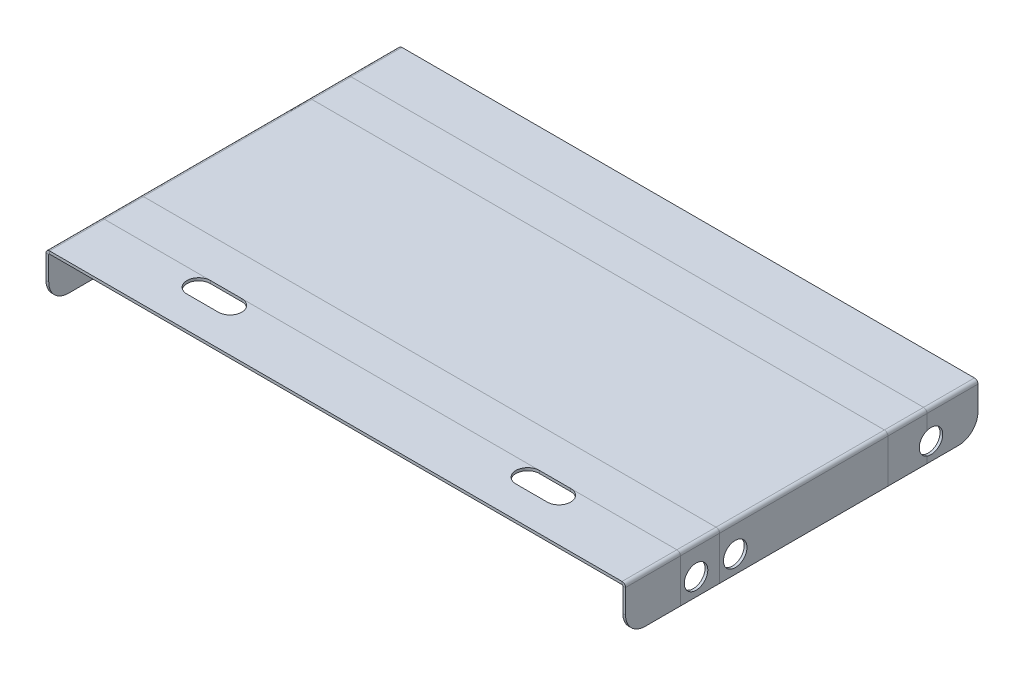
from build123d import *

# Parameters (mm, degrees)
SKETCH_1_W                         = 148
SKETCH_1_H                         = 90
SM_BASE_FLANGE_1_DEPTH             = 0.7
SM_EDGE_FLANGE_1_STRIP_W           = 3.2
SM_EDGE_FLANGE_1_STRIP_H           = 0.7
SM_EDGE_FLANGE_1_STRIP_CUT_DEPTH   = 90
SM_EDGE_FLANGE_1_STRIP_2_W         = 3.2
SM_EDGE_FLANGE_1_STRIP_2_H         = 0.7
SM_EDGE_FLANGE_1_STRIP_CUT_2_DEPTH = 90
SM_EDGE_FLANGE_1_DEPTH             = 90
SM_EDGE_FLANGE_1_PROFILE_W         = 90
SM_EDGE_FLANGE_1_PROFILE_H         = 11.1
SM_EDGE_FLANGE_1_PROFILE_R         = 3
SM_EDGE_FLANGE_1_FLAT_DEPTH        = 0.7
SM_EDGE_FLANGE_1_BEND_DEPTH        = 90
FILLET_2_R                         = 5
CUT_EXTRUDE_START                  = -10
SKETCH_15_R                        = 3
CUT_EXTRUDE_1_DEPTH                = 10
SPLIT_BODIES_1_SURFACE_1_1_BACK    = 174.632
SPLIT_BODIES_1_SURFACE_1_1_DEPTH   = 349.264
SPLIT_BODIES_1_SURFACE_1_2_BACK    = 174.632
SPLIT_BODIES_1_SURFACE_1_2_DEPTH   = 349.264
SPLIT_BODIES_1_SURFACE_2_3_BACK    = 174.632
SPLIT_BODIES_1_SURFACE_2_3_DEPTH   = 349.264
SPLIT_BODIES_1_SURFACE_2_4_BACK    = 174.632
SPLIT_BODIES_1_SURFACE_2_4_DEPTH   = 349.264
SPLIT_BODIES_1_SURFACE_3_5_BACK    = 174.632
SPLIT_BODIES_1_SURFACE_3_5_DEPTH   = 349.264
SPLIT_BODIES_1_SURFACE_3_6_BACK    = 174.632
SPLIT_BODIES_1_SURFACE_3_6_DEPTH   = 349.264
SPLIT_BODIES_1_SURFACE_4_7_BACK    = 174.632
SPLIT_BODIES_1_SURFACE_4_7_DEPTH   = 349.264
SPLIT_BODIES_1_SURFACE_4_8_BACK    = 174.632
SPLIT_BODIES_1_SURFACE_4_8_DEPTH   = 349.264


# Sheet-metal steps are written as plain solids
with BuildPart() as part:
    # Sketch 1 → 基体-法兰1 (new body)
    with BuildSketch(Plane(origin=(0, 0, 0), x_dir=(1, 0, 0), z_dir=(0, 1, 0))):
        Rectangle(SKETCH_1_W, SKETCH_1_H)
        with BuildLine():
            Line((-46, -31), (-38, -31))
            ThreePointArc((-38, -31), (-35, -34), (-38, -37))
            Line((-38, -37), (-46, -37))
            ThreePointArc((-46, -37), (-49, -34), (-46, -31))
        make_face(mode=Mode.SUBTRACT)
        with BuildLine():
            Line((38, -31), (46, -31))
            ThreePointArc((46, -31), (49, -34), (46, -37))
            Line((46, -37), (38, -37))
            ThreePointArc((38, -37), (35, -34), (38, -31))
        make_face(mode=Mode.SUBTRACT)
    extrude(amount=-SM_BASE_FLANGE_1_DEPTH)

    # 边线-法兰1 strip (across the edge) → 边线-法兰1 strip cut (cut)
    with BuildSketch(Plane(origin=(74, -0.7, -45), x_dir=(-1, 0, 0), z_dir=(0, 0, 1))):
        with Locations((-0.7, -0.35)):
            Rectangle(SM_EDGE_FLANGE_1_STRIP_W, SM_EDGE_FLANGE_1_STRIP_H)
    extrude(amount=SM_EDGE_FLANGE_1_STRIP_CUT_DEPTH, mode=Mode.SUBTRACT)

    # 边线-法兰1 strip 2 (across the edge) → 边线-法兰1 strip cut 2 (cut)
    with BuildSketch(Plane(origin=(-74, -0.7, 45), x_dir=(1, 0, 0), z_dir=(0, 0, -1))):
        with Locations((-0.7, -0.35)):
            Rectangle(SM_EDGE_FLANGE_1_STRIP_2_W, SM_EDGE_FLANGE_1_STRIP_2_H)
    extrude(amount=SM_EDGE_FLANGE_1_STRIP_CUT_2_DEPTH, mode=Mode.SUBTRACT)

    # 边线-法兰1 bend section (across the edge) → 边线-法兰1 (add)
    with BuildSketch(Plane(origin=(74, -0.7, -45), x_dir=(-1, 0, 0), z_dir=(0, 0, 1))):
        with BuildLine():
            Line((0, 0.2), (0.7, 0.2))
            ThreePointArc((0.7, 0.2), (0.758578644, 0.058578644), (0.9, 0))
            Line((0.9, 0), (0.9, -0.7))
            ThreePointArc((0.9, -0.7), (0.263603897, -0.436396103), (0, 0.2))
        make_face()
    extrude(amount=SM_EDGE_FLANGE_1_DEPTH)

    # 边线-法兰1 profile (on flange) → 边线-法兰1 flat (add)
    with BuildSketch(Plane(origin=(74, -0.7, 0), x_dir=(0, 0, 1), z_dir=(1, 0, 0))):
        with Locations((0, 5.75)):
            Rectangle(SM_EDGE_FLANGE_1_PROFILE_W, SM_EDGE_FLANGE_1_PROFILE_H)
        with Locations((17, 6.8)):
            Circle(SM_EDGE_FLANGE_1_PROFILE_R, mode=Mode.SUBTRACT)
        with Locations((27, 6.8)):
            Circle(SM_EDGE_FLANGE_1_PROFILE_R, mode=Mode.SUBTRACT)
        with Locations((-33, 6.8)):
            Circle(SM_EDGE_FLANGE_1_PROFILE_R, mode=Mode.SUBTRACT)
    extrude(amount=-SM_EDGE_FLANGE_1_FLAT_DEPTH)

    # 边线-法兰1 section (across the edge) → 边线-法兰1 bend (add)
    with BuildSketch(Plane(origin=(-74, -0.7, 45), x_dir=(1, 0, 0), z_dir=(0, 0, -1))):
        with BuildLine():
            Line((0, 0.2), (0, 11.3))
            Line((0, 11.3), (0.7, 11.3))
            Line((0.7, 11.3), (0.7, 0.2))
            ThreePointArc((0.7, 0.2), (0.758578644, 0.058578644), (0.9, 0))
            Line((0.9, 0), (0.9, -0.7))
            ThreePointArc((0.9, -0.7), (0.263603897, -0.436396103), (0, 0.2))
        make_face()
    extrude(amount=SM_EDGE_FLANGE_1_BEND_DEPTH)

    # 圆角2
    fillet_2_edges = [part.edges().sort_by_distance(p)[0] for p in [
        (-73.65, -12, 45),
        (-73.65, -12, -45),
        (73.65, -12, -45),
        (73.65, -12, 45),
    ]]
    fillet(fillet_2_edges, radius=FILLET_2_R)

    # 草图15 → 切除-拉伸1 (cut)
    with BuildSketch(Plane.ZY.offset(74).offset(CUT_EXTRUDE_START)):
        with Locations(Location((-33, -7.5, 0), (0, 0, 270))):
            Circle(SKETCH_15_R)
        with Locations(Location((17, -7.5, 0), (0, 0, 270))):
            Circle(SKETCH_15_R)
        with Locations(Location((27, -7.5, 0), (0, 0, 270))):
            Circle(SKETCH_15_R)
    extrude(amount=CUT_EXTRUDE_1_DEPTH, mode=Mode.SUBTRACT)


with BuildPart() as body_2:
    # Split Bodies 1: the piece behind the surface
    add(part.part)
    # Split Bodies 1 surface 1: a surface, the sketch's curves swept straight by 349.264 mm
    with BuildLine(Plane(origin=(0, 0, 0), x_dir=(1, 0, 0), z_dir=(0, 1, 0)).offset(-SPLIT_BODIES_1_SURFACE_1_1_BACK), mode=Mode.PRIVATE) as split_bodies_1_surface_1_1_path:
        Line((-74, 32), (74, 32))
    split_bodies_1_surface_1_1 = Shell.extrude(split_bodies_1_surface_1_1_path.wire(), (0 * SPLIT_BODIES_1_SURFACE_1_1_DEPTH, 1 * SPLIT_BODIES_1_SURFACE_1_1_DEPTH, 0 * SPLIT_BODIES_1_SURFACE_1_1_DEPTH))
    split(bisect_by=split_bodies_1_surface_1_1, keep=Keep.BOTTOM)


with BuildPart() as part_1:
    add(part.part)

    # Split Bodies 1: split by a surface, the side it looks to stays
    # Split Bodies 1 surface 1: a surface, the sketch's curves swept straight by 349.264 mm
    with BuildLine(Plane(origin=(0, 0, 0), x_dir=(1, 0, 0), z_dir=(0, 1, 0)).offset(-SPLIT_BODIES_1_SURFACE_1_2_BACK), mode=Mode.PRIVATE) as split_bodies_1_surface_1_2_path:
        Line((-74, 32), (74, 32))
    split_bodies_1_surface_1_2 = Shell.extrude(split_bodies_1_surface_1_2_path.wire(), (0 * SPLIT_BODIES_1_SURFACE_1_2_DEPTH, 1 * SPLIT_BODIES_1_SURFACE_1_2_DEPTH, 0 * SPLIT_BODIES_1_SURFACE_1_2_DEPTH))
    split(bisect_by=split_bodies_1_surface_1_2, keep=Keep.TOP)


with BuildPart() as body_3:
    # Split Bodies 1 2 body 2: the piece behind the surface
    add(body_2.part)
    # Split Bodies 1 surface 2: a surface, the sketch's curves swept straight by 349.264 mm
    with BuildLine(Plane(origin=(0, 0, 0), x_dir=(1, 0, 0), z_dir=(0, 1, 0)).offset(-SPLIT_BODIES_1_SURFACE_2_3_BACK), mode=Mode.PRIVATE) as split_bodies_1_surface_2_3_path:
        Line((-74, -31), (74, -31))
    split_bodies_1_surface_2_3 = Shell.extrude(split_bodies_1_surface_2_3_path.wire(), (0 * SPLIT_BODIES_1_SURFACE_2_3_DEPTH, 1 * SPLIT_BODIES_1_SURFACE_2_3_DEPTH, 0 * SPLIT_BODIES_1_SURFACE_2_3_DEPTH))
    split(bisect_by=split_bodies_1_surface_2_3, keep=Keep.BOTTOM)


with BuildPart() as body_2_1:
    add(body_2.part)

    # Split Bodies 1 2 body 2: split by a surface, the side it looks to stays
    # Split Bodies 1 surface 2: a surface, the sketch's curves swept straight by 349.264 mm
    with BuildLine(Plane(origin=(0, 0, 0), x_dir=(1, 0, 0), z_dir=(0, 1, 0)).offset(-SPLIT_BODIES_1_SURFACE_2_4_BACK), mode=Mode.PRIVATE) as split_bodies_1_surface_2_4_path:
        Line((-74, -31), (74, -31))
    split_bodies_1_surface_2_4 = Shell.extrude(split_bodies_1_surface_2_4_path.wire(), (0 * SPLIT_BODIES_1_SURFACE_2_4_DEPTH, 1 * SPLIT_BODIES_1_SURFACE_2_4_DEPTH, 0 * SPLIT_BODIES_1_SURFACE_2_4_DEPTH))
    split(bisect_by=split_bodies_1_surface_2_4, keep=Keep.TOP)


with BuildPart() as body_4:
    # Split Bodies 1 3 body 2: the piece behind the surface
    add(body_2_1.part)
    # Split Bodies 1 surface 3: a surface, the sketch's curves swept straight by 349.264 mm
    with BuildLine(Plane(origin=(0, 0, 0), x_dir=(1, 0, 0), z_dir=(0, 1, 0)).offset(-SPLIT_BODIES_1_SURFACE_3_5_BACK), mode=Mode.PRIVATE) as split_bodies_1_surface_3_5_path:
        Line((-74, -16), (-73.1, -16))
        Line((-73.1, -16), (-73.1, -21))
        Line((-73.1, -21), (74, -21))
    split_bodies_1_surface_3_5 = Shell.extrude(split_bodies_1_surface_3_5_path.wire(), (0 * SPLIT_BODIES_1_SURFACE_3_5_DEPTH, 1 * SPLIT_BODIES_1_SURFACE_3_5_DEPTH, 0 * SPLIT_BODIES_1_SURFACE_3_5_DEPTH))
    split(bisect_by=split_bodies_1_surface_3_5, keep=Keep.BOTTOM)


with BuildPart() as body_2_2:
    add(body_2_1.part)

    # Split Bodies 1 3 body 2: split by a surface, the side it looks to stays
    # Split Bodies 1 surface 3: a surface, the sketch's curves swept straight by 349.264 mm
    with BuildLine(Plane(origin=(0, 0, 0), x_dir=(1, 0, 0), z_dir=(0, 1, 0)).offset(-SPLIT_BODIES_1_SURFACE_3_6_BACK), mode=Mode.PRIVATE) as split_bodies_1_surface_3_6_path:
        Line((-74, -16), (-73.1, -16))
        Line((-73.1, -16), (-73.1, -21))
        Line((-73.1, -21), (74, -21))
    split_bodies_1_surface_3_6 = Shell.extrude(split_bodies_1_surface_3_6_path.wire(), (0 * SPLIT_BODIES_1_SURFACE_3_6_DEPTH, 1 * SPLIT_BODIES_1_SURFACE_3_6_DEPTH, 0 * SPLIT_BODIES_1_SURFACE_3_6_DEPTH))
    split(bisect_by=split_bodies_1_surface_3_6, keep=Keep.TOP)


with BuildPart() as body_5_2:
    # Split Bodies 1 4 body 2: the piece behind the surface
    add(body_2_2.part)
    # Split Bodies 1 surface 4: a surface, the sketch's curves swept straight by 349.264 mm
    with BuildLine(Plane(origin=(0, 0, 0), x_dir=(1, 0, 0), z_dir=(0, 1, 0)).offset(-SPLIT_BODIES_1_SURFACE_4_7_BACK), mode=Mode.PRIVATE) as split_bodies_1_surface_4_7_path:
        Line((-74, 17), (-73.1, 17))
        Line((-73.1, 17), (-73.1, 22))
        Line((-73.1, 22), (74, 22))
    split_bodies_1_surface_4_7 = Shell.extrude(split_bodies_1_surface_4_7_path.wire(), (0 * SPLIT_BODIES_1_SURFACE_4_7_DEPTH, 1 * SPLIT_BODIES_1_SURFACE_4_7_DEPTH, 0 * SPLIT_BODIES_1_SURFACE_4_7_DEPTH))
    split(bisect_by=split_bodies_1_surface_4_7, keep=Keep.BOTTOM)


with BuildPart() as body_2_3:
    add(body_2_2.part)

    # Split Bodies 1 4 body 2: split by a surface, the side it looks to stays
    # Split Bodies 1 surface 4: a surface, the sketch's curves swept straight by 349.264 mm
    with BuildLine(Plane(origin=(0, 0, 0), x_dir=(1, 0, 0), z_dir=(0, 1, 0)).offset(-SPLIT_BODIES_1_SURFACE_4_8_BACK), mode=Mode.PRIVATE) as split_bodies_1_surface_4_8_path:
        Line((-74, 17), (-73.1, 17))
        Line((-73.1, 17), (-73.1, 22))
        Line((-73.1, 22), (74, 22))
    split_bodies_1_surface_4_8 = Shell.extrude(split_bodies_1_surface_4_8_path.wire(), (0 * SPLIT_BODIES_1_SURFACE_4_8_DEPTH, 1 * SPLIT_BODIES_1_SURFACE_4_8_DEPTH, 0 * SPLIT_BODIES_1_SURFACE_4_8_DEPTH))
    split(bisect_by=split_bodies_1_surface_4_8, keep=Keep.TOP)


solid = Compound([part_1.part, body_3.part, body_4.part, body_5_2.part, body_2_3.part])
